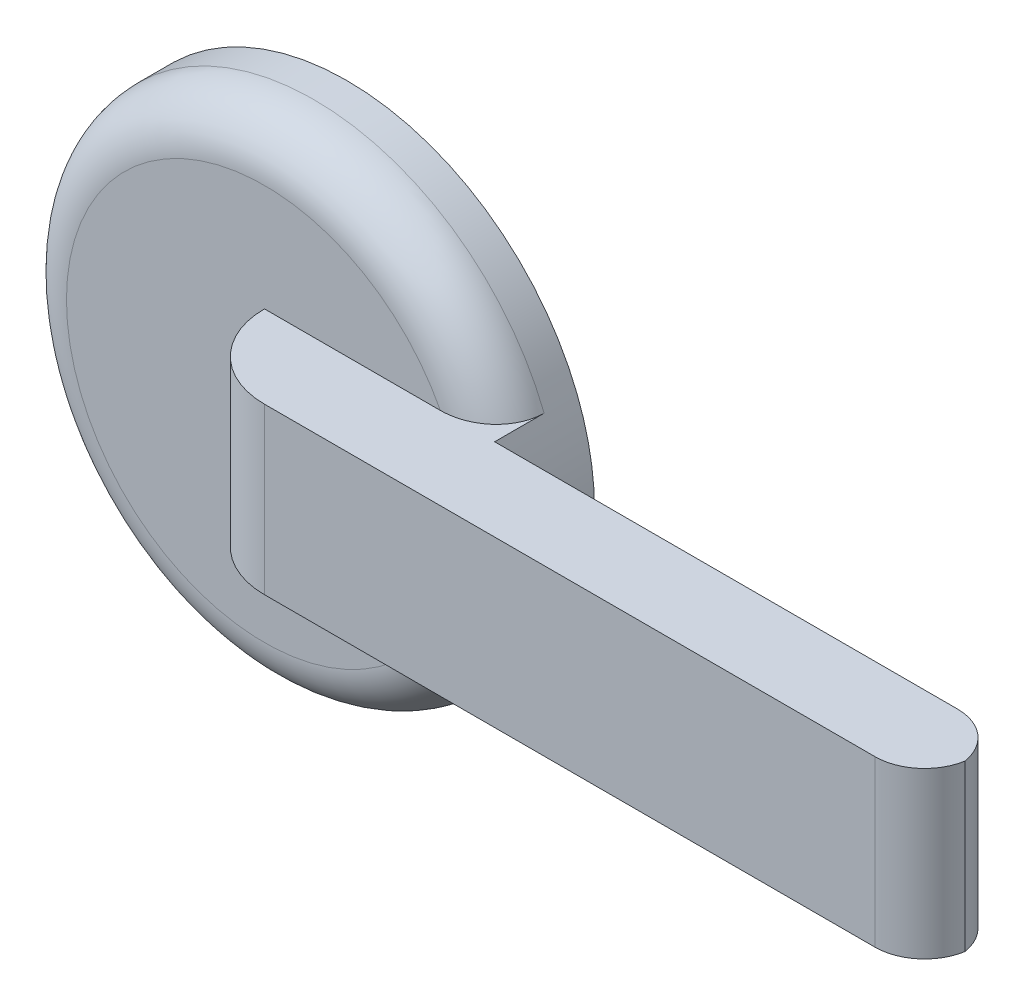
from build123d import *

# Parameters (mm, degrees)
SKETCH1_R           = 38.1
BOSS_EXTRUDE1_DEPTH = 12.7
SKETCH2_W           = 114.3
SKETCH2_H           = 25.4
BOSS_EXTRUDE2_DEPTH = 12.7
FILLET1_R           = 12.7
FILLET4_R           = 7.62
FILLET5_R           = 7.62


# Some blends are built 0.0001 mm under size
with BuildPart() as part:
    # Sketch1 → Boss-Extrude1 (new body)
    with BuildSketch(Plane.XY):
        Circle(SKETCH1_R)
    extrude(amount=BOSS_EXTRUDE1_DEPTH)

    # Sketch2 → Boss-Extrude2 (add)
    with BuildSketch(Plane.XY.offset(12.7)):
        with Locations((57.15, 1.312743298)):
            Rectangle(SKETCH2_W, SKETCH2_H)
    extrude(amount=BOSS_EXTRUDE2_DEPTH)

    # Fillet1
    fillet1_edges = [part.edges().sort_by_distance(p)[0] for p in [
        (0, 1.312743298, 25.4),
    ]]
    fillet(fillet1_edges, radius=FILLET1_R - 0.0001)  # a hair under: the kernel refuses the full size

    # Fillet4
    # the kernel refuses this fillet: 7.62 mm, written as the material it takes off along each edge
    with BuildSketch(Plane(origin=(114.3, -30.437256702, 12.7), x_dir=(-1, 0, 0), z_dir=(0, 1, 0))) as fillet4_piece_1:
        with BuildLine():
            CenterArc((FILLET4_R, FILLET4_R), FILLET4_R, 180, 90)
            Line((0, FILLET4_R), (0, 0))
            Line((0, 0), (FILLET4_R, 0))
        make_face()
    extrude(amount=63.5, mode=Mode.SUBTRACT)
    with BuildSketch(Plane(origin=(114.3, -30.437256702, 25.4), x_dir=(-1, 0, 0), z_dir=(0, 1, 0))) as fillet4_piece_2:
        with BuildLine():
            CenterArc((FILLET4_R, -FILLET4_R), FILLET4_R, 90, 90)
            Line((0, -FILLET4_R), (0, 0))
            Line((0, 0), (FILLET4_R, 0))
        make_face()
    extrude(amount=63.5, mode=Mode.SUBTRACT)

    # Fillet5
    fillet5_edges = [part.edges().sort_by_distance(p)[0] for p in [
        (-38.074544895, -1.392490946, 12.7),
    ]]
    fillet(fillet5_edges, radius=FILLET5_R)


solid = part.part
